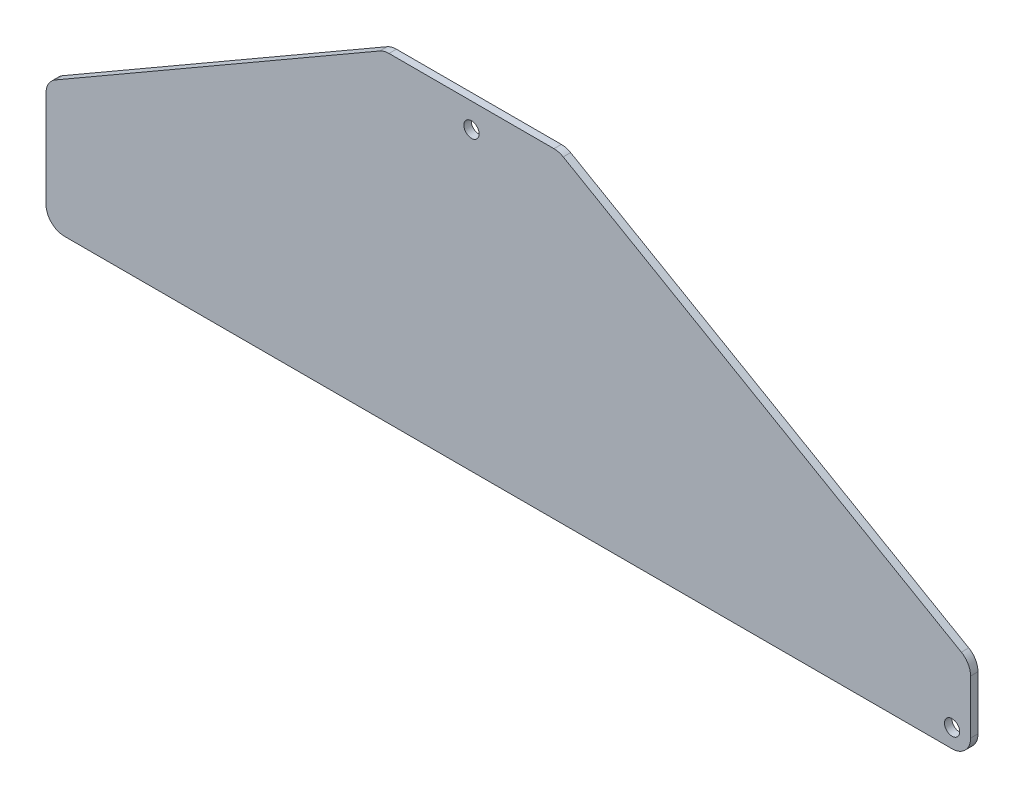
from build123d import *

# Parameters (mm, degrees)
BOSS_EXTRUDE1_DEPTH = 1.6
SKETCH2_R           = 1.65
CUT_EXTRUDE1_DEPTH  = 166.406922962
FILLET1_R           = 4


with BuildPart() as part:
    # Sketch1 → Boss-Extrude1 (new body)
    with BuildSketch(Plane.XY):
        Polygon((-92, 56), (107.923048454, 56), (107.923048454, 73.945262452), (18.908965344, 125.337567297), (-18.908965344, 125.337567297), (-92, 83.138438763), align=None)
    extrude(amount=BOSS_EXTRUDE1_DEPTH)

    # Sketch2 → Cut-Extrude1 (cut, through all)
    with BuildSketch(Plane.XY.offset(1.6)):
        with Locations((0, 120)):
            Circle(SKETCH2_R)
        with Locations((103.923048454, 60)):
            Circle(SKETCH2_R)
    extrude(amount=-CUT_EXTRUDE1_DEPTH, mode=Mode.SUBTRACT)

    # Fillet1
    fillet1_edges = [part.edges().sort_by_distance(p)[0] for p in [
        (-18.908965344, 125.337567297, 0.8),
        (18.908965344, 125.337567297, 0.8),
        (107.923048454, 73.945262452, 0.8),
        (107.923048454, 56, 0.8),
        (-92, 56, 0.8),
        (-92, 83.138438763, 0.8),
    ]]
    fillet(fillet1_edges, radius=FILLET1_R)


solid = part.part
